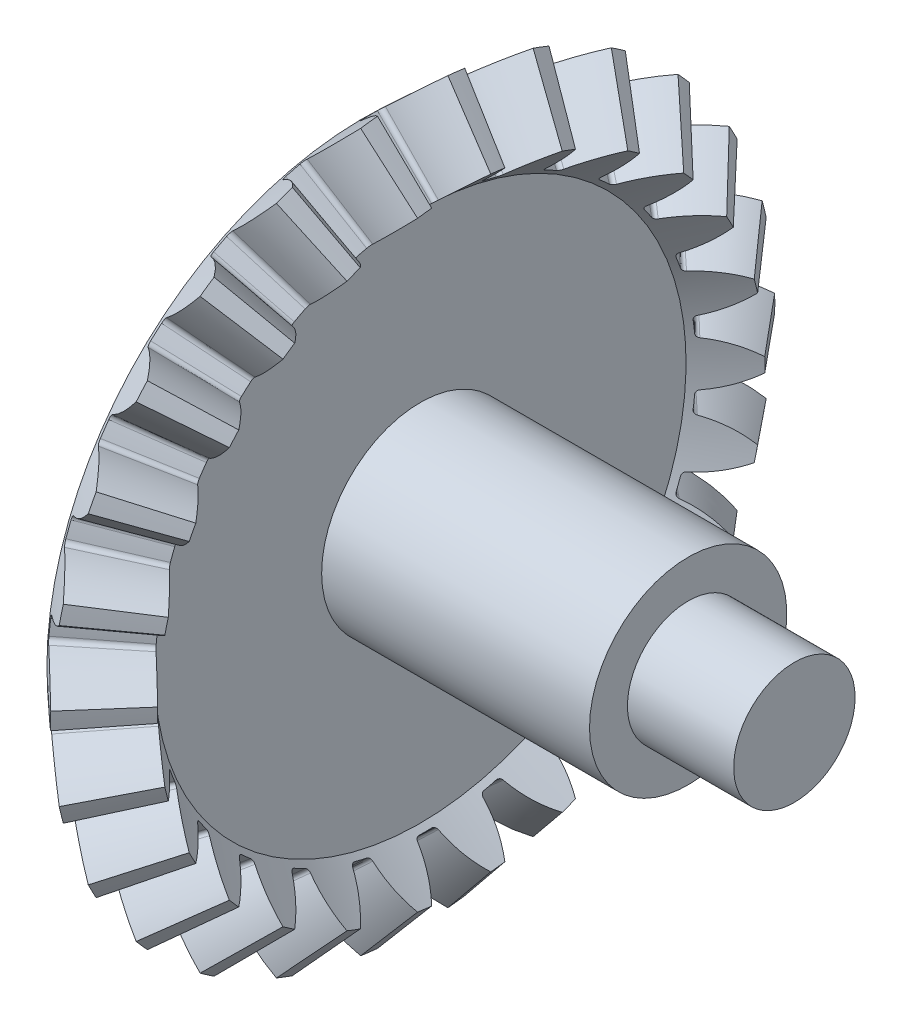
from build123d import *

# Parameters (mm, degrees)
TEETHCUTS_COUNT     = 26
TEETHCUTS_ANGLE     = 346.153846154
HUBSKE_R            = 4
HUB_DEPTH           = 0.0001016
BORSKE_R            = 2.5
BORE_DEPTH          = 23.019917858
SKETCH1_R           = 10
CUT_EXTRUDE1_DEPTH  = 10
SKETCH1_2_R         = 10
BOSS_EXTRUDE1_DEPTH = 3.717599472
SKETCH2_R           = 6.5
BOSS_EXTRUDE2_DEPTH = 17.649999998
SKETCH3_R           = 4
BOSS_EXTRUDE3_DEPTH = 7


with BuildPart() as part:
    # BasProSke → Base-Revolve (revolve)
    with BuildSketch(Plane(origin=(0, 0, 0), x_dir=(1, 0, 0), z_dir=(0, 1, 0)), mode=Mode.PRIVATE) as base_revolve_sk:
        Polygon((0, 0), (0, 20.885507333), (3.218270607, 23.856218658), (6.416134622, 20.003552359), (3.717599472, 17.51259684), (3.717599472, 0), align=None)
    revolve(base_revolve_sk.sketch.rotate(Axis((-10, 0, 0), (1, 0, 0)), 180), axis=Axis((-10, 0, 0), (1, 0, 0)))

    # ToothCut: read off the stored shape, not the designer's step
    # ToothCut: loft between two sections, ruled curve by curve
    toothcut_from = [
        Edge.make_bspline([(23.026510041, 0.006131983, -0.008919588), (23.021998953, 0.001967902, -0.015141997), (23.015606807, -0.00393254, -0.014285782), (23.012073699, -0.007193871, -0.00698587)], [0, 0, 0, 0, 1, 1, 1, 1], 3, [1, 0.752816672, 0.752816672, 1]),
        Edge.make_bspline([(23.012073699, -0.007193871, 0.00698587), (23.015606807, -0.00393254, 0.014285782), (23.021998953, 0.001967902, 0.015141997), (23.026510041, 0.006131983, 0.008919588)], [0, 0, 0, 0, 1, 1, 1, 1], 3, [1, 0.752816672, 0.752816672, 1]),
        Edge.make_bspline([(23.012073699, -0.007193871, -0.00698587), (23.011608559, -0.007623231, -0.006024823), (23.01124308, -0.007960597, -0.004987071), (23.010983962, -0.008199782, -0.003891642)], [0, 0, 0, 0, 1, 1, 1, 1], 3, [1, 0.993888935, 0.993888935, 1]),
        Edge.make_bspline([(23.010983962, -0.008199782, 0.003891642), (23.01124308, -0.007960597, 0.004987071), (23.011608559, -0.007623231, 0.006024823), (23.012073699, -0.007193871, 0.00698587)], [0, 0, 0, 0, 1, 1, 1, 1], 3, [1, 0.993888935, 0.993888935, 1]),
        Edge.make_bspline([(23.010983962, -0.008199782, -0.003891642), (23.010380433, -0.008756886, -0.001340195), (23.010380433, -0.008756886, 0.001340195), (23.010983962, -0.008199782, 0.003891642)], [0, 0, 0, 0, 1, 1, 1, 1], 3, [1, 0.967929126, 0.967929126, 1]),
        Edge.make_line((23.026510041, 0.006131983, 0.008919588), (23.026510041, 0.006131983, -0.008919588)),
    ]
    toothcut_to = [
        Edge.make_bspline([(3.473042415, 24.091392634, -2.643476416), (2.631372433, 23.314466498, -1.72385277), (1.653290725, 22.411621846, -1.102597642), (0.594773134, 21.434528687, -0.815265607)], [0, 0, 0, 0, 1, 1, 1, 1], 3, [1, 0.980923256, 0.980923256, 1]),
        Edge.make_bspline([(0.594773134, 21.434528687, 0.815265607), (1.653290725, 22.411621846, 1.102597642), (2.631372433, 23.314466498, 1.72385277), (3.473042415, 24.091392634, 2.643476416)], [0, 0, 0, 0, 1, 1, 1, 1], 3, [1, 0.980923256, 0.980923256, 1]),
        Edge.make_bspline([(0.594773134, 21.434528687, -0.815265607), (0.473914998, 21.322967331, -0.782458958), (0.396885474, 21.251863155, -0.651540855), (0.399787128, 21.254541605, -0.48387062)], [0, 0, 0, 0, 1, 1, 1, 1], 3, [1, 0.843771736, 0.843771736, 1]),
        Edge.make_bspline([(0.399787128, 21.254541605, 0.48387062), (0.396885474, 21.251863155, 0.651540855), (0.473914998, 21.322967331, 0.782458958), (0.594773134, 21.434528687, 0.815265607)], [0, 0, 0, 0, 1, 1, 1, 1], 3, [1, 0.843771736, 0.843771736, 1]),
        Edge.make_bspline([(0.399787128, 21.254541605, -0.48387062), (0.405369098, 21.259694192, -0.161320021), (0.405369098, 21.259694192, 0.161320021), (0.399787128, 21.254541605, 0.48387062)], [0, 0, 0, 0, 1, 1, 1, 1], 3, [1, 0.999815186, 0.999815186, 1]),
        Edge.make_line((3.473042415, 24.091392634, 2.643476416), (3.473042415, 24.091392634, -2.643476416)),
    ]
    toothcut = Solid(Shell([*[Face.make_surface_from_curves(toothcut_from[k], toothcut_to[k]) for k in range(6)], Face(Wire(toothcut_from)), Face(Wire(toothcut_to))]))
    add(toothcut, mode=Mode.SUBTRACT)

    # TeethCuts: ToothCut ×26 about axis
    teethcuts_axis = Axis((-10, 0, 0), (1, 0, 0))
    for i in range(1, TEETHCUTS_COUNT):
        add(toothcut.rotate(teethcuts_axis, i * TEETHCUTS_ANGLE / (TEETHCUTS_COUNT - 1)), mode=Mode.SUBTRACT)

    # HubSke → Hub (add)
    with BuildSketch(Plane.ZY):
        with Locations(Location((0, 0, 0), (0, 0, 180))):
            Circle(HUBSKE_R)
    extrude(amount=HUB_DEPTH)

    # BorSke → Bore (cut, symmetric)
    with BuildSketch(Plane(origin=(0, 0, 0), x_dir=(0, 0, -1), z_dir=(1, 0, 0))):
        with Locations(Location((0, 0, 0), (0, 0, 180))):
            Circle(BORSKE_R)
    extrude(amount=BORE_DEPTH, both=True, mode=Mode.SUBTRACT)

    # Sketch1 → Cut-Extrude1 (cut)
    with BuildSketch(Plane.ZY):
        Circle(SKETCH1_R)
    extrude(amount=-CUT_EXTRUDE1_DEPTH, mode=Mode.SUBTRACT)


with BuildPart() as cut_extrude1_kept_piece:
    # of the separate pieces the step leaves, the one the design keeps (cut_extrude1_pieces_kept)
    add(part.part.solids().sort_by_distance((0, 0, 20.885507333))[0])

    # Sketch1<2> → Boss-Extrude1 (add)
    with BuildSketch(Plane.ZY):
        Circle(SKETCH1_2_R)
    extrude(amount=-BOSS_EXTRUDE1_DEPTH)

    # Sketch2 → Boss-Extrude2 (add)
    with BuildSketch(Plane(origin=(3.717599472, 0, 0), x_dir=(0, 0, -1), z_dir=(1, 0, 0))):
        with Locations(Location((0, 0, 0), (0, 0, 180))):
            Circle(SKETCH2_R)
    extrude(amount=BOSS_EXTRUDE2_DEPTH)

    # Sketch3 → Boss-Extrude3 (add)
    with BuildSketch(Plane(origin=(21.36759947, 0, 0), x_dir=(0, 0, -1), z_dir=(1, 0, 0))):
        Circle(SKETCH3_R)
    extrude(amount=BOSS_EXTRUDE3_DEPTH)


solid = cut_extrude1_kept_piece.part
